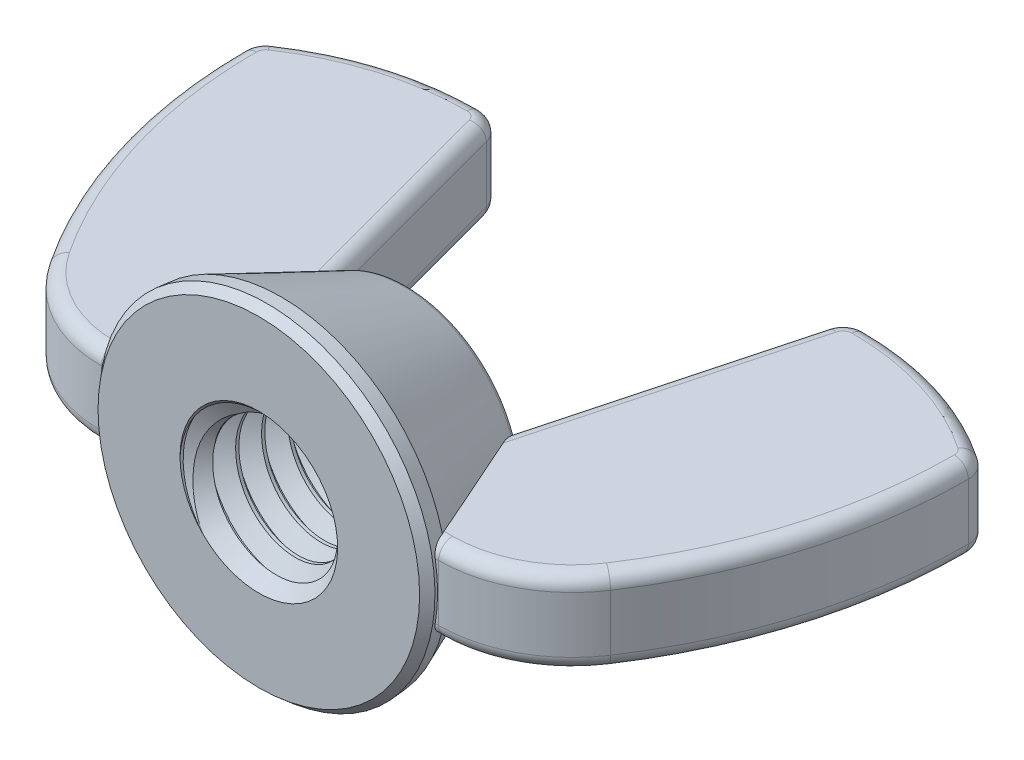
from build123d import *

# Parameters (mm, degrees)
EXTRUDE2_DEPTH     = 1.28984375
SKETCH3_R          = 5.159375
EXTRUDE1_DEPTH     = 0.6858
EXTRUDE1_DRAFT     = -5
SKETCH15_R         = 5.099375275
EXTRUDE3_DEPTH     = 3.8862
EXTRUDE3_TAPER     = 22.89012698
FILLET3_R          = 0.254
SKETCH4_R          = 2.413
CUT_EXTRUDE1_DEPTH = 18.646438922
SWEEP1_PITCH       = 0.79375
SKETCH7_R          = 5.159375
CUT_EXTRUDE2_DEPTH = 18.646438952
SKETCH8_R          = 5.099375275
CUT_EXTRUDE3_DEPTH = 15.702761362
SKETCH11_R         = 2.3622
CUT_EXTRUDE5_DEPTH = 15.702761327
CUT_EXTRUDE5_TAPER = 45
CHAMFER1_SIZE      = 0.257175
CHAMFER1_SIZE2     = 0.237388559
FILLET4_R          = 0.429947917


with BuildPart() as part:
    # Sketch13 → Extrude2 (new, symmetric)
    with BuildSketch(Plane(origin=(0, 0, 0), x_dir=(1, 0, 0), z_dir=(0, 1, 0))):
        with BuildLine():
            Line((3.166712045, 0.3429), (5.159375, 0.3429))
            ThreePointArc((5.159375, 0.3429), (7.101768744, 0.832103373), (8.580723973, 2.182993757))
            ThreePointArc((8.580723973, 2.182993757), (10.465874951, 6.208977734), (11.1125, 10.607183874))
            ThreePointArc((11.1125, 10.607183874), (11.028622602, 10.943597741), (10.796626512, 11.201255503))
            ThreePointArc((10.796626512, 11.201255503), (8.457534763, 12.316945036), (5.894454148, 12.7))
            ThreePointArc((5.894454148, 12.7), (5.458227968, 12.551921165), (5.202291154, 12.168884654))
            Line((5.202291154, 12.168884654), (3.166712045, 4.572))
            Line((3.166712045, 4.572), (3.166712045, 0.3429))
        make_face()
    extrude(amount=EXTRUDE2_DEPTH, both=True)

    # Fillet4
    fillet4_edges = [part.edges().sort_by_distance(p)[0] for p in [
        (7.101768744, 1.28984375, -0.832103373),
        (4.163043523, -1.28984375, -0.3429),
        (10.465874951, 1.28984375, -6.208977734),
        (11.028622602, 1.28984375, -10.943597741),
        (8.457534763, 1.28984375, -12.316945036),
        (5.458227968, 1.28984375, -12.551921165),
        (4.1845016, 1.28984375, -8.370442327),
        (4.163043523, 1.28984375, -0.3429),
        (4.1845016, -1.28984375, -8.370442327),
        (5.458227968, -1.28984375, -12.551921165),
        (8.457534763, -1.28984375, -12.316945036),
        (11.028622602, -1.28984375, -10.943597741),
        (10.465874951, -1.28984375, -6.208977734),
        (7.101768744, -1.28984375, -0.832103373),
    ]]
    fillet(fillet4_edges, radius=FILLET4_R)


with BuildPart() as body_2:
    # Sketch3 → Extrude1 (with draft: the straight prism first)
    with BuildSketch(Plane.XY):
        Circle(SKETCH3_R)
    extrude(amount=-EXTRUDE1_DEPTH)
    # Extrude1: the draft: its side faces are tilted about the plane it starts from
    extrude1_sides = [body_2.faces().sort_by_distance(p)[0] for p in [
        (-5.159375, 0, -0.3429),
    ]]
    draft(extrude1_sides, Plane.XY, EXTRUDE1_DRAFT)

    # Sketch15 → Extrude3 (add)
    with BuildSketch(Plane(origin=(0, 0, -0.6858), x_dir=(-1, 0, 0), z_dir=(0, 0, -1))):
        Circle(SKETCH15_R)
    extrude(amount=EXTRUDE3_DEPTH, taper=EXTRUDE3_TAPER)

    # Fillet3
    fillet3_edges = [body_2.edges().sort_by_distance(p)[0] for p in [
        (3.458569214, 0, -4.572),
    ]]
    fillet(fillet3_edges, radius=FILLET3_R)

    # Sketch4 → Cut-Extrude1 (cut, through all)
    with BuildSketch(Plane.XY):
        Circle(SKETCH4_R)
    extrude(amount=-CUT_EXTRUDE1_DEPTH, mode=Mode.SUBTRACT)

    # Sweep1: the profile of Sketch6 profile screwed along a right-hand helix of 9.76 turns, 6 arcs to a turn; built about Z, then put on its axis
    sweep1_z = Axis((0, 0, 0), (0, 0, 1))
    sweep1_corners = [(2.4133, 0, -0.694704455), (1.897444252, 0, -0.396875), (1.897444252, 0, -0.29765625), (2.4133, 0, 0.000173205)]
    with BuildLine(mode=Mode.PRIVATE) as sweep1_profile:
        Line(sweep1_corners[0], sweep1_corners[1])
        Line(sweep1_corners[1], sweep1_corners[2])
        Line(sweep1_corners[2], sweep1_corners[3])
        Line(sweep1_corners[3], sweep1_corners[0])
    sweep1_cap = Face(sweep1_profile.wire())
    sweep1_turn_angles = [0, 30, 60, 90, 120, 150, 180, 210, 240, 270, 300, 330, 360]
    sweep1_turn_weights = [1, 0.8660254037844387, 1, 0.8660254037844387, 1, 0.8660254037844387, 1, 0.8660254037844387, 1, 0.8660254037844387, 1, 0.8660254037844387, 1]
    sweep1_turn_rails = [Edge.make_bspline([Vector(p[0], p[1], 0).rotate(sweep1_z, sweep1_turn_angles[k]) / sweep1_turn_weights[k] + Vector(0, 0, p[2] + SWEEP1_PITCH * sweep1_turn_angles[k] / 360) for k in range(13)], [0, 0, 0, 1, 1, 2, 2, 3, 3, 4, 4, 5, 5, 6, 6, 6], 2, sweep1_turn_weights) for p in sweep1_corners]
    sweep1_turn_sides = [Face.make_surface_from_curves(sweep1_turn_rails[p[0]], sweep1_turn_rails[p[1]]) for p in [(0, 1), (1, 2), (2, 3), (3, 0)]]
    sweep1_turn = Solid(Shell([*sweep1_turn_sides, sweep1_cap, sweep1_cap.rotate(sweep1_z, 360).moved(Location((0, 0, SWEEP1_PITCH * 360 / 360)))]))
    sweep1_last_angles = [3240, 3270, 3300, 3330, 3360, 3390, 3420, 3450, 3480, 3496.8, 3513.6]
    sweep1_last_weights = [1, 0.8660254037844387, 1, 0.8660254037844387, 1, 0.8660254037844387, 1, 0.8660254037844387, 1, 0.9573194975320721, 1]
    sweep1_last_rails = [Edge.make_bspline([Vector(p[0], p[1], 0).rotate(sweep1_z, sweep1_last_angles[k]) / sweep1_last_weights[k] + Vector(0, 0, p[2] + SWEEP1_PITCH * sweep1_last_angles[k] / 360) for k in range(11)], [0, 0, 0, 1, 1, 2, 2, 3, 3, 4, 4, 5, 5, 5], 2, sweep1_last_weights) for p in sweep1_corners]
    sweep1_last_sides = [Face.make_surface_from_curves(sweep1_last_rails[p[0]], sweep1_last_rails[p[1]]) for p in [(0, 1), (1, 2), (2, 3), (3, 0)]]
    sweep1_last = Solid(Shell([*sweep1_last_sides, sweep1_cap.rotate(sweep1_z, 3240).moved(Location((0, 0, SWEEP1_PITCH * 3240 / 360))), sweep1_cap.rotate(sweep1_z, 3513.6).moved(Location((0, 0, SWEEP1_PITCH * 3513.6 / 360)))]))
    sweep1_each = [*[sweep1_turn.moved(Location((0, 0, SWEEP1_PITCH * i))) for i in range(9)], sweep1_last]
    add(Plane(origin=(0, 0, 0), x_dir=(-1, 0, 0), z_dir=(0, 0, -1)) * Compound([sweep1_each[i] for i in range(0, 10, 2)]))
    add(Plane(origin=(0, 0, 0), x_dir=(-1, 0, 0), z_dir=(0, 0, -1)) * Compound([sweep1_each[i] for i in range(1, 10, 2)]))

    # Sketch7 → Cut-Extrude2 (cut, through all)
    with BuildSketch(Plane.XY):
        Circle(SKETCH7_R)
    extrude(amount=CUT_EXTRUDE2_DEPTH, mode=Mode.SUBTRACT)

    # Sketch8 → Cut-Extrude3 (cut, through all)
    with BuildSketch(Plane.XY.offset(-4.572)):
        Circle(SKETCH8_R)
    extrude(amount=-CUT_EXTRUDE3_DEPTH, mode=Mode.SUBTRACT)

    # Cut-Extrude4 cone 1 section (through the dimple's axis) → Cut-Extrude4 (revolve, cut)
    with BuildSketch(Plane(origin=(0, 0, 0), x_dir=(0, -1, 0), z_dir=(1, 0, 0))):
        Polygon((0, 0), (2.413, 0), (0, 2.413), align=None)
    revolve(axis=Axis((0, 0, 0), (0, 0, -1)), mode=Mode.SUBTRACT)

    # Sketch11 → Cut-Extrude5 (cut, through all)
    with BuildSketch(Plane.XY.offset(-4.572)):
        Circle(SKETCH11_R)
    extrude(amount=CUT_EXTRUDE5_DEPTH, taper=CUT_EXTRUDE5_TAPER, mode=Mode.SUBTRACT)

    # Chamfer1
    chamfer1_edges = [body_2.edges().sort_by_distance(p)[0] for p in [
        (-5.159375, 0, 0),
    ]]
    chamfer1_side = [body_2.faces().sort_by_distance(p)[0] for p in [
        (-5.129375137, 0, -0.3429),
    ]]
    chamfer(chamfer1_edges, length=CHAMFER1_SIZE, length2=CHAMFER1_SIZE2, reference=chamfer1_side[0])


with BuildPart() as body_3:
    # Mirror6: mirrored copy
    add(part.part.mirror(Plane(origin=(0, 0, 0), x_dir=(0, 0, 1), z_dir=(1, 0, 0))))

    # Combine2: union part, body 2
    add(part.part)
    add(body_2.part)


solid = body_3.part
